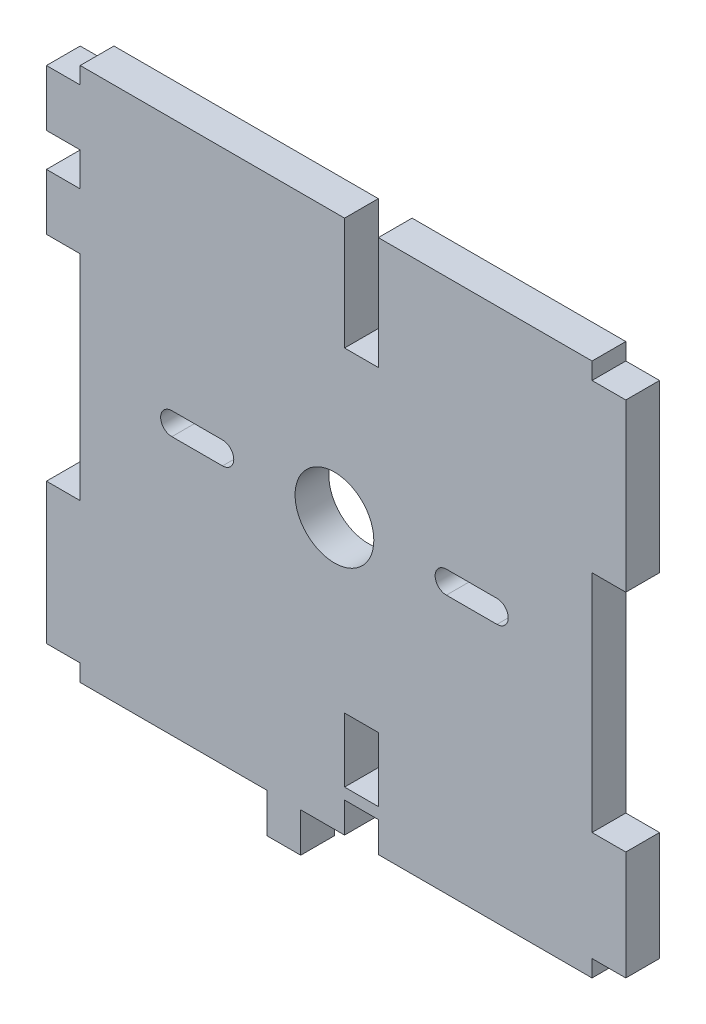
from build123d import *

# Parameters (mm, degrees)
ESQUISSE1_R               = 3.5
ESQUISSE1_W               = 3
ESQUISSE1_H               = 5.702159315
T_LE_DE_BASE_PLI_E1_DEPTH = 3


# Sheet-metal steps are written as plain solids
with BuildPart() as part:
    # Esquisse1 → Tôle de base pliée1 (new body)
    with BuildSketch(Plane.XY):
        Polygon((29.5, 47.5), (29.5, 37.5), (26.5, 37.5), (26.5, 47.5), (3, 47.5), (3, 46), (0, 46), (0, 41), (3, 41), (3, 38), (0, 38), (0, 33), (3, 33), (3, 14), (0, 14), (0, 1.5), (3, 1.5), (3, 0), (19.6, 0), (19.6, -3.5), (22.6, -3.5), (22.6, 0), (26.5, 0), (26.5, 2.7), (29.5, 2.7), (29.5, 0), (48.5, 0), (48.5, 1.5), (51.5, 1.5), (51.5, 11.2), (48.5, 11.2), (48.5, 31.2), (51.5, 31.2), (51.5, 46), (48.5, 46), (48.5, 47.5), align=None)
        with Locations((25.6, 24)):
            Circle(ESQUISSE1_R, mode=Mode.SUBTRACT)
        with BuildLine():
            Line((35.55, 25), (40.05, 25))
            ThreePointArc((40.05, 25), (41.05, 24), (40.05, 23))
            Line((40.05, 23), (35.55, 23))
            ThreePointArc((35.55, 23), (34.55, 24), (35.55, 25))
        make_face(mode=Mode.SUBTRACT)
        with BuildLine():
            Line((11.15, 25), (15.65, 25))
            ThreePointArc((15.65, 25), (16.65, 24), (15.65, 23))
            Line((15.65, 23), (11.15, 23))
            ThreePointArc((11.15, 23), (10.15, 24), (11.15, 25))
        make_face(mode=Mode.SUBTRACT)
        with Locations((28, 6.548920343)):
            Rectangle(ESQUISSE1_W, ESQUISSE1_H, mode=Mode.SUBTRACT)
    extrude(amount=-T_LE_DE_BASE_PLI_E1_DEPTH)


solid = part.part
